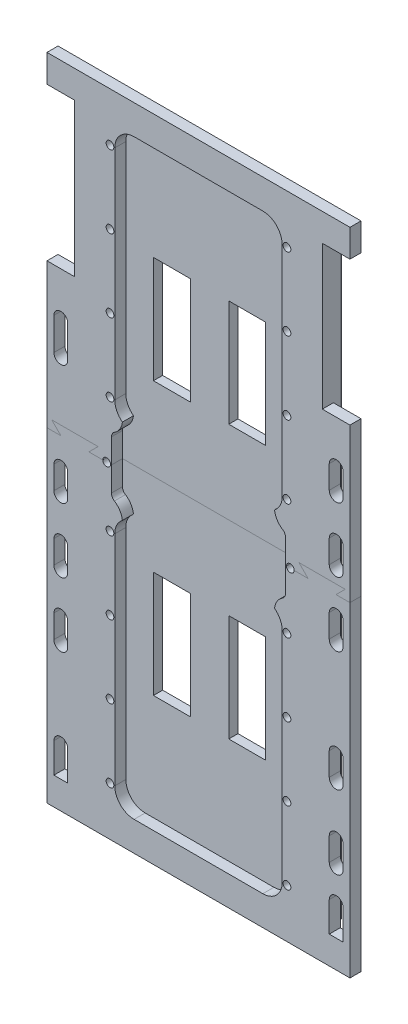
from build123d import *

# Parameters (mm, degrees)
SKETCH1_W               = 134.5
SKETCH1_H               = 323
BOSS_EXTRUDE1_DEPTH     = 5
SKETCH1_3_W             = 134.5
SKETCH1_3_H             = 323
BOSS_EXTRUDE2_DEPTH     = 6
BOSS_EXTRUDE8_START     = 0.1
BOSS_EXTRUDE8_DEPTH     = 6
SKETCH3_W               = 164.5
SKETCH3_H               = 15
BOSS_EXTRUDE9_DEPTH     = 6
SKETCH4_R               = 1.8
CUT_EXTRUDE1_DEPTH      = 196.034131628
CHAMFER1_SIZE           = 0.3
CHAMFER1_SIZE2          = 10
FILLET1_R               = 1
CUT_EXTRUDE2_DEPTH      = 195.816099181
CUT_EXTRUDE2_DEPTH_BACK = 195.816099181
SKETCH6_W               = 20
SKETCH6_H               = 58
SPLIT1_SURFACE_1_BACK   = 390.603
SPLIT1_SURFACE_1_DEPTH  = 781.206
SPLIT1_SURFACE_2_BACK   = 390.603
SPLIT1_SURFACE_2_DEPTH  = 781.206


# Read off the part's stored shape, not the designer's step: Boss-Extrude8
with BuildPart() as part:
    # Sketch1 → Boss-Extrude1 (new body)
    with BuildSketch(Plane(origin=(0, 0, 0.1), x_dir=(1, 0, 0), z_dir=(0, 0, -1))):
        Rectangle(SKETCH1_W, SKETCH1_H)
    extrude(amount=BOSS_EXTRUDE1_DEPTH)

    # Sketch1<3> → Boss-Extrude2 (add)
    with BuildSketch(Plane(origin=(0, 0, 0.1), x_dir=(1, 0, 0), z_dir=(0, 0, -1))):
        Rectangle(SKETCH1_3_W, SKETCH1_3_H)
        with BuildLine():
            Line((45.45, 31.485659466), (45.45, 150))
            ThreePointArc((45.45, 150), (42.66589269, 157.121446482), (35.79, 160.466346067))
            ThreePointArc((35.79, 160.466346067), (35.370336944, 160.491583143), (34.95, 160.5))
            Line((34.95, 160.5), (-34.95, 160.5))
            ThreePointArc((-34.95, 160.5), (-35.370336944, 160.491583143), (-35.79, 160.466346067))
            ThreePointArc((-35.79, 160.466346067), (-42.66589269, 157.121446482), (-45.45, 150))
            Line((-45.45, 150), (-45.45, 31.485659466))
            ThreePointArc((-45.45, 31.485659466), (-44.357328362, 26.821736965), (-41.306728934, 23.128507005))
            ThreePointArc((-41.306728934, 23.128507005), (-42.679763233, 19.15303821), (-45.634615385, 16.159975549))
            ThreePointArc((-45.634615385, 16.159975549), (-46.819703068, 14.892045855), (-47.25, 13.21070024))
            Line((-47.25, 13.21070024), (-47.25, -13.21070024))
            ThreePointArc((-47.25, -13.21070024), (-46.819703068, -14.892045855), (-45.634615385, -16.159975549))
            ThreePointArc((-45.634615385, -16.159975549), (-42.679763233, -19.15303821), (-41.306728934, -23.128507005))
            ThreePointArc((-41.306728934, -23.128507005), (-44.357328362, -26.821736965), (-45.45, -31.485659466))
            Line((-45.45, -31.485659466), (-45.45, -150))
            ThreePointArc((-45.45, -150), (-42.66589269, -157.121446482), (-35.79, -160.466346067))
            ThreePointArc((-35.79, -160.466346067), (-35.370336944, -160.491583143), (-34.95, -160.5))
            Line((-34.95, -160.5), (34.95, -160.5))
            ThreePointArc((34.95, -160.5), (35.370336944, -160.491583143), (35.79, -160.466346067))
            ThreePointArc((35.79, -160.466346067), (42.66589269, -157.121446482), (45.45, -150))
            Line((45.45, -150), (45.45, -31.485659466))
            ThreePointArc((45.45, -31.485659466), (44.357328362, -26.821736965), (41.306728934, -23.128507005))
            ThreePointArc((41.306728934, -23.128507005), (42.679763233, -19.15303821), (45.634615385, -16.159975549))
            ThreePointArc((45.634615385, -16.159975549), (46.819703068, -14.892045855), (47.25, -13.21070024))
            Line((47.25, -13.21070024), (47.25, 13.21070024))
            ThreePointArc((47.25, 13.21070024), (46.819703068, 14.892045855), (45.634615385, 16.159975549))
            ThreePointArc((45.634615385, 16.159975549), (42.679763233, 19.15303821), (41.306728934, 23.128507005))
            ThreePointArc((41.306728934, 23.128507005), (44.357328362, 26.821736965), (45.45, 31.485659466))
        make_face(mode=Mode.SUBTRACT)
    extrude(amount=-BOSS_EXTRUDE2_DEPTH)

    # Boss-Extrude8 outline → Boss-Extrude8 (add)
    # profile 1 of 2: a face of its own
    with BuildSketch(Plane.XY.offset(BOSS_EXTRUDE8_START)):
        with BuildLine():
            Line((-71, -161.5), (-67.25, -161.5))
            Line((-67.25, -161.5), (-67.25, 78.5))
            Line((-67.25, 78.5), (-82.25, 78.5))
            Line((-82.25, 78.5), (-82.25, -161.5))
            Line((-82.25, -161.5), (-78.5, -161.5))
            Line((-78.5, -161.5), (-78.5, -145.25))
            ThreePointArc((-78.5, -145.25), (-74.75, -141.5), (-71, -145.25))
            Line((-71, -145.25), (-71, -161.5))
        make_face()
        with BuildLine():
            ThreePointArc((-78.5, -85.25), (-74.75, -81.5), (-71, -85.25))
            Line((-71, -85.25), (-71, -97.75))
            ThreePointArc((-71, -97.75), (-74.75, -101.5), (-78.5, -97.75))
            Line((-78.5, -97.75), (-78.5, -85.25))
        make_face(mode=Mode.SUBTRACT)
        with BuildLine():
            ThreePointArc((-78.5, -50.25), (-74.75, -46.5), (-71, -50.25))
            Line((-71, -50.25), (-71, -62.75))
            ThreePointArc((-71, -62.75), (-74.75, -66.5), (-78.5, -62.75))
            Line((-78.5, -62.75), (-78.5, -50.25))
        make_face(mode=Mode.SUBTRACT)
        with BuildLine():
            ThreePointArc((-78.5, -15.25), (-74.75, -11.5), (-71, -15.25))
            Line((-71, -15.25), (-71, -27.75))
            ThreePointArc((-71, -27.75), (-74.75, -31.5), (-78.5, -27.75))
            Line((-78.5, -27.75), (-78.5, -15.25))
        make_face(mode=Mode.SUBTRACT)
        with BuildLine():
            ThreePointArc((-78.5, 54.75), (-74.75, 58.5), (-71, 54.75))
            Line((-71, 54.75), (-71, 37.25))
            ThreePointArc((-71, 37.25), (-74.75, 33.5), (-78.5, 37.25))
            Line((-78.5, 37.25), (-78.5, 54.75))
        make_face(mode=Mode.SUBTRACT)
    # profile 2 of 2: a face of its own
    with BuildSketch(Plane.XY.offset(BOSS_EXTRUDE8_START)):
        with BuildLine():
            Line((78.5, -161.5), (82.25, -161.5))
            Line((82.25, -161.5), (82.25, 83.5))
            Line((82.25, 83.5), (67.25, 83.5))
            Line((67.25, 83.5), (67.25, -161.5))
            Line((67.25, -161.5), (71, -161.5))
            Line((71, -161.5), (71, -145.25))
            ThreePointArc((71, -145.25), (74.75, -141.5), (78.5, -145.25))
            Line((78.5, -145.25), (78.5, -161.5))
        make_face()
        with BuildLine():
            ThreePointArc((71, -115.25), (74.75, -111.5), (78.5, -115.25))
            Line((78.5, -115.25), (78.5, -127.75))
            ThreePointArc((78.5, -127.75), (74.75, -131.5), (71, -127.75))
            Line((71, -127.75), (71, -115.25))
        make_face(mode=Mode.SUBTRACT)
        with BuildLine():
            ThreePointArc((71, -75.25), (74.75, -71.5), (78.5, -75.25))
            Line((78.5, -75.25), (78.5, -87.75))
            ThreePointArc((78.5, -87.75), (74.75, -91.5), (71, -87.75))
            Line((71, -87.75), (71, -75.25))
        make_face(mode=Mode.SUBTRACT)
        with BuildLine():
            ThreePointArc((71, -10.25), (74.75, -6.5), (78.5, -10.25))
            Line((78.5, -10.25), (78.5, -22.75))
            ThreePointArc((78.5, -22.75), (74.75, -26.5), (71, -22.75))
            Line((71, -22.75), (71, -10.25))
        make_face(mode=Mode.SUBTRACT)
        with BuildLine():
            ThreePointArc((71, 24.75), (74.75, 28.5), (78.5, 24.75))
            Line((78.5, 24.75), (78.5, 12.25))
            ThreePointArc((78.5, 12.25), (74.75, 8.5), (71, 12.25))
            Line((71, 12.25), (71, 24.75))
        make_face(mode=Mode.SUBTRACT)
        with BuildLine():
            ThreePointArc((71, 59.75), (74.75, 63.5), (78.5, 59.75))
            Line((78.5, 59.75), (78.5, 47.25))
            ThreePointArc((78.5, 47.25), (74.75, 43.5), (71, 47.25))
            Line((71, 47.25), (71, 59.75))
        make_face(mode=Mode.SUBTRACT)
    extrude(amount=BOSS_EXTRUDE8_DEPTH)

    # Sketch3 → Boss-Extrude9 (add)
    with BuildSketch(Plane.XY.offset(0.1)):
        with Locations((0, 169)):
            Rectangle(SKETCH3_W, SKETCH3_H)
        with Locations((0, -169)):
            Rectangle(SKETCH3_W, SKETCH3_H)
    extrude(amount=BOSS_EXTRUDE9_DEPTH)

    # Sketch4 → Cut-Extrude1 (cut, through all)
    with BuildSketch(Plane.XY.offset(6.1)):
        with Locations((-48.05, -150)):
            Circle(SKETCH4_R)
        with Locations((-49.85, 0)):
            Circle(SKETCH4_R)
        with Locations((-48.05, -31.485659466)):
            Circle(SKETCH4_R)
        with Locations((-48.05, 31.485659466)):
            Circle(SKETCH4_R)
        with Locations((-48.05, 150)):
            Circle(SKETCH4_R)
        with Locations((-48.05, 70.990439644)):
            Circle(SKETCH4_R)
        with Locations((-48.05, -70.990439644)):
            Circle(SKETCH4_R)
        with Locations((-48.05, 110.495219822)):
            Circle(SKETCH4_R)
        with Locations((-48.05, -110.495219822)):
            Circle(SKETCH4_R)
        with Locations(Location((48.05, -110.495219822, 0), (0, 0, 180))):
            Circle(SKETCH4_R)
        with Locations(Location((48.05, 110.495219822, 0), (0, 0, 180))):
            Circle(SKETCH4_R)
        with Locations(Location((48.05, -70.990439644, 0), (0, 0, 180))):
            Circle(SKETCH4_R)
        with Locations(Location((48.05, 70.990439644, 0), (0, 0, 180))):
            Circle(SKETCH4_R)
        with Locations(Location((48.05, 150, 0), (0, 0, 180))):
            Circle(SKETCH4_R)
        with Locations(Location((48.05, 31.485659466, 0), (0, 0, 180))):
            Circle(SKETCH4_R)
        with Locations(Location((48.05, -31.485659466, 0), (0, 0, 180))):
            Circle(SKETCH4_R)
        with Locations(Location((49.85, 0, 0), (0, 0, 180))):
            Circle(SKETCH4_R)
        with Locations(Location((48.05, -150, 0), (0, 0, 180))):
            Circle(SKETCH4_R)
    extrude(amount=-CUT_EXTRUDE1_DEPTH, mode=Mode.SUBTRACT)

    # Chamfer1
    chamfer1_edges = [part.edges().sort_by_distance(p)[0] for p in [
        (49.85, -150, 6.1),
        (-49.85, 70.990439644, 6.1),
        (-49.85, -70.990439644, 6.1),
        (49.85, -110.495219822, 6.1),
        (-49.85, 110.495219822, 6.1),
        (-49.85, 150, 6.1),
        (-49.85, 31.485659466, 6.1),
        (-49.85, -31.485659466, 6.1),
        (-51.65, 0, 6.1),
        (51.65, 0, 6.1),
        (49.85, -31.485659466, 6.1),
        (49.85, 31.485659466, 6.1),
        (49.85, 150, 6.1),
        (-49.85, -110.495219822, 6.1),
        (49.85, 110.495219822, 6.1),
        (49.85, -70.990439644, 6.1),
        (49.85, 70.990439644, 6.1),
        (-49.85, -150, 6.1),
    ]]
    chamfer1_side = [part.faces().sort_by_distance(p)[0] for p in [
        (74.75, 79.605526351, 6.1),
    ]]
    chamfer(chamfer1_edges, length=CHAMFER1_SIZE, length2=CHAMFER1_SIZE2, reference=chamfer1_side[0])

    # Fillet1
    fillet1_edges = [part.edges().sort_by_distance(p)[0] for p in [
        (0, -161.5, -4.9),
        (-67.25, 0, -4.9),
        (0, 161.5, -4.9),
        (67.25, 0, -4.9),
    ]]
    fillet(fillet1_edges, radius=FILLET1_R)

    # Sketch6 → Cut-Extrude2 (cut, two sides: drawn at the far end of the back side and taken through both)
    with BuildSketch(Plane.XY.offset(0.1).offset(-CUT_EXTRUDE2_DEPTH_BACK)):
        with Locations((20.45, 74)):
            Rectangle(SKETCH6_W, SKETCH6_H)
        with Locations((-20.45, 74)):
            Rectangle(SKETCH6_W, SKETCH6_H)
        with Locations((-20.45, -74)):
            Rectangle(SKETCH6_W, SKETCH6_H)
        with Locations((20.45, -74)):
            Rectangle(SKETCH6_W, SKETCH6_H)
    extrude(amount=CUT_EXTRUDE2_DEPTH + CUT_EXTRUDE2_DEPTH_BACK, mode=Mode.SUBTRACT)


with BuildPart() as body_2:
    # Split1: the piece behind the surface
    add(part.part)
    # Split1 surface: a surface, the sketch's curves swept straight by 781.206 mm
    with BuildLine(Plane.XY.offset(6.1).offset(-SPLIT1_SURFACE_1_BACK), mode=Mode.PRIVATE) as split1_surface_1_path:
        Line((-82.25, 0), (-74.675, 0))
        Line((-74.675, 0), (-79.675, 5))
        Line((-79.675, 5), (-54.525, 5))
        Line((-54.525, 5), (-59.525, 0))
        Line((-59.525, 0), (-51.95, 0))
        Line((-51.95, 0), (51.95, 0))
        Line((51.95, 0), (59.525, 0))
        Line((59.525, 0), (54.525, 5))
        Line((54.525, 5), (79.675, 5))
        Line((79.675, 5), (74.675, 0))
        Line((74.675, 0), (82.25, 0))
    split1_surface_1 = Shell.extrude(split1_surface_1_path.wire(), (0 * SPLIT1_SURFACE_1_DEPTH, 0 * SPLIT1_SURFACE_1_DEPTH, 1 * SPLIT1_SURFACE_1_DEPTH))
    split(bisect_by=split1_surface_1, keep=Keep.BOTTOM)


with BuildPart() as part_1:
    add(part.part)

    # Split1: split by a surface, the side it looks to stays
    # Split1 surface: a surface, the sketch's curves swept straight by 781.206 mm
    with BuildLine(Plane.XY.offset(6.1).offset(-SPLIT1_SURFACE_2_BACK), mode=Mode.PRIVATE) as split1_surface_2_path:
        Line((-82.25, 0), (-74.675, 0))
        Line((-74.675, 0), (-79.675, 5))
        Line((-79.675, 5), (-54.525, 5))
        Line((-54.525, 5), (-59.525, 0))
        Line((-59.525, 0), (-51.95, 0))
        Line((-51.95, 0), (51.95, 0))
        Line((51.95, 0), (59.525, 0))
        Line((59.525, 0), (54.525, 5))
        Line((54.525, 5), (79.675, 5))
        Line((79.675, 5), (74.675, 0))
        Line((74.675, 0), (82.25, 0))
    split1_surface_2 = Shell.extrude(split1_surface_2_path.wire(), (0 * SPLIT1_SURFACE_2_DEPTH, 0 * SPLIT1_SURFACE_2_DEPTH, 1 * SPLIT1_SURFACE_2_DEPTH))
    split(bisect_by=split1_surface_2, keep=Keep.TOP)


solid = Compound([body_2.part, part_1.part])
